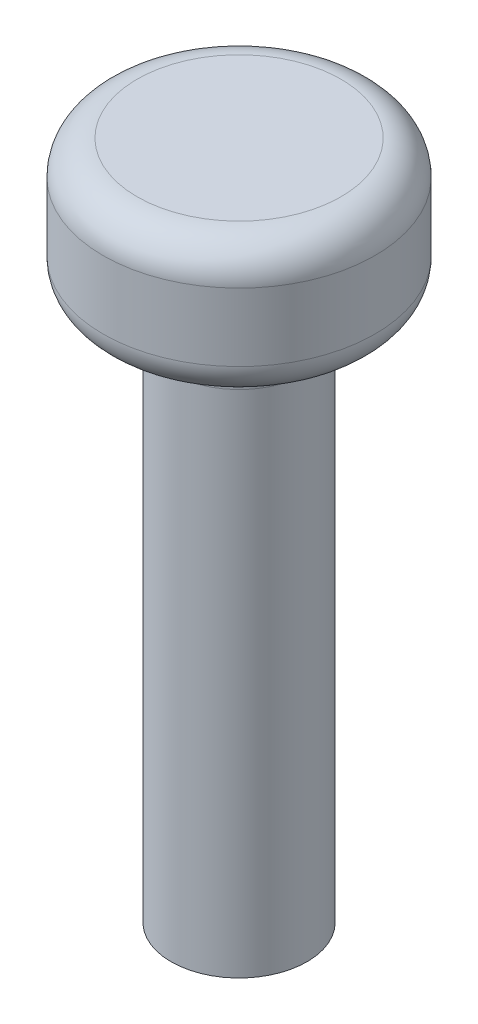
from build123d import *

# Parameters (mm, degrees)
SKETCH1_R           = 1
BOSS_EXTRUDE1_DEPTH = 8
SKETCH2_R           = 2
BOSS_EXTRUDE2_DEPTH = 2
FILLET1_R           = 0.5
FILLET2_R           = 0.5


with BuildPart() as part:
    # Sketch1 → Boss-Extrude1 (new body)
    with BuildSketch(Plane(origin=(0, 0, 0), x_dir=(1, 0, 0), z_dir=(0, 1, 0))):
        with Locations(Location((0, 0, 0), (0, 0, 270))):
            Circle(SKETCH1_R)
    extrude(amount=BOSS_EXTRUDE1_DEPTH)

    # Sketch2 → Boss-Extrude2 (add)
    with BuildSketch(Plane(origin=(0, 8, 0), x_dir=(1, 0, 0), z_dir=(0, 1, 0))):
        with Locations(Location((0, 0, 0), (0, 0, 270))):
            Circle(SKETCH2_R)
    extrude(amount=BOSS_EXTRUDE2_DEPTH)

    # Fillet1
    fillet1_edges = [part.edges().sort_by_distance(p)[0] for p in [
        (0, 8, -1),
    ]]
    fillet(fillet1_edges, radius=FILLET1_R)

    # Fillet2
    fillet2_edges = [part.edges().sort_by_distance(p)[0] for p in [
        (0, 8, -2),
        (0, 10, -2),
    ]]
    fillet(fillet2_edges, radius=FILLET2_R - 0.0001)  # a hair under: the kernel refuses the full size


solid = part.part
